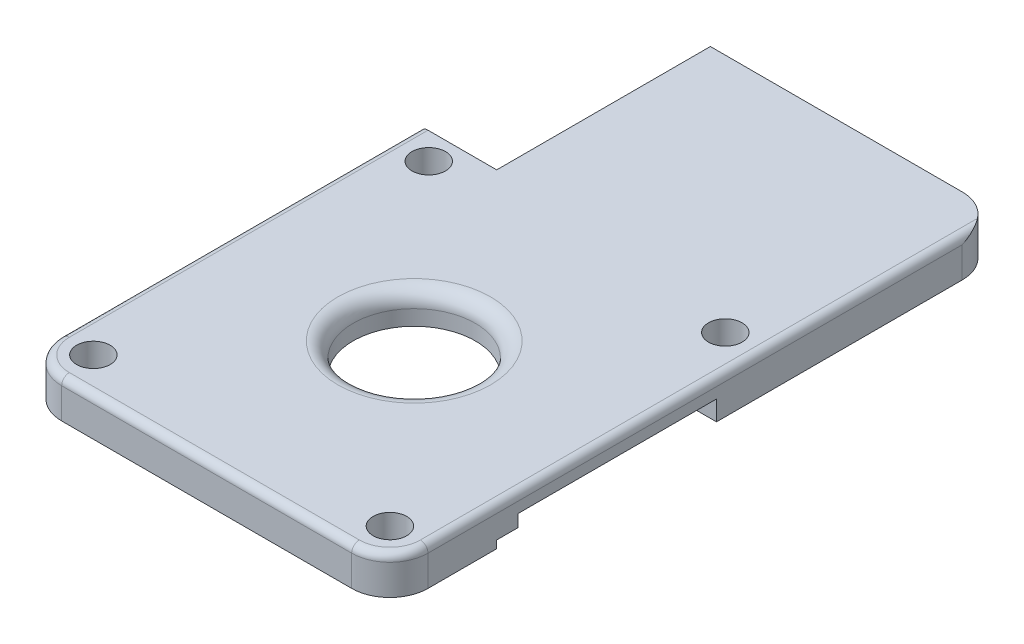
from build123d import *

# Parameters (mm, degrees)
SKETCH_1_R           = 1.1
SKETCH_1_R_2         = 4
EXTRUDE_1_DEPTH      = 2.5
SKETCH_2_W           = 14.4
SKETCH_2_H           = 0.5
CUT_EXTRUDE_1_DEPTH  = 37.005863078
SKETCH_3_W           = 13
SKETCH_3_H           = 1.3
CUT_EXTRUDE_2_DEPTH  = 4.5
SKETCH_4_W           = 13
SKETCH_4_H           = 1.3
CUT_EXTRUDE_3_DEPTH  = 4.5
SKETCH_5_W           = 11.5
SKETCH_5_H           = 17.3
CUT_EXTRUDE_11_DEPTH = 0.5
SKETCH_6_W           = 6
SKETCH_6_H           = 10
CUT_EXTRUDE_12_DEPTH = 0.5
FILLET_1_R           = 0.5
FILLET_2_R           = 1
SKETCH_7_W           = 4.3
SKETCH_7_H           = 13.3
CUT_EXTRUDE_13_DEPTH = 30.401057536
CHAMFER_1_SIZE       = 0.699461487
CHAMFER_1_SIZE_2     = 1.5


with BuildPart() as part:
    # 草图1 → 凸台-拉伸1 (new body)
    with BuildSketch(Plane(origin=(0, 0, 0), x_dir=(1, 0, 0), z_dir=(0, 1, 0))):
        with BuildLine():
            Line((-12, 24.224), (-12, -10.776))
            ThreePointArc((-12, -10.776), (-11.267766953, -12.543766953), (-9.5, -13.276))
            Line((-9.5, -13.276), (9.5, -13.276))
            ThreePointArc((9.5, -13.276), (11.267766953, -12.543766953), (12, -10.776))
            Line((12, -10.776), (12, 24.224))
            ThreePointArc((12, 24.224), (11.267766953, 25.991766953), (9.5, 26.724))
            Line((9.5, 26.724), (-9.5, 26.724))
            ThreePointArc((-9.5, 26.724), (-11.267766953, 25.991766953), (-12, 24.224))
        make_face()
        with Locations(Location((-9.714, -10.986, 0), (0, 0, 270))):
            Circle(SKETCH_1_R, mode=Mode.SUBTRACT)
        with Locations(Location((0, 0.32, 0), (0, 0, 270))):
            Circle(SKETCH_1_R_2, mode=Mode.SUBTRACT)
        with Locations(Location((9.714, -10.986, 0), (0, 0, 270))):
            Circle(SKETCH_1_R, mode=Mode.SUBTRACT)
        with Locations(Location((9.714, 10.986, 0), (0, 0, 270))):
            Circle(SKETCH_1_R, mode=Mode.SUBTRACT)
        with Locations(Location((-9.714, 10.986, 0), (0, 0, 270))):
            Circle(SKETCH_1_R, mode=Mode.SUBTRACT)
    extrude(amount=-EXTRUDE_1_DEPTH)

    # 草图2 → 切除-拉伸1 (cut, through all)
    with BuildSketch(Plane(origin=(12, 0, 0), x_dir=(0, 0, -1), z_dir=(1, 0, 0))):
        with Locations((0.924, -2.25)):
            Rectangle(SKETCH_2_W, SKETCH_2_H)
    extrude(amount=-CUT_EXTRUDE_1_DEPTH, mode=Mode.SUBTRACT)

    # 草图3 → 切除-拉伸2 (cut)
    with BuildSketch(Plane(origin=(12, 0, 0), x_dir=(0, 0, -1), z_dir=(1, 0, 0))):
        with Locations((1.624, -1.85)):
            Rectangle(SKETCH_3_W, SKETCH_3_H)
    extrude(amount=-CUT_EXTRUDE_2_DEPTH, mode=Mode.SUBTRACT)

    # 草图4 → 切除-拉伸3 (cut)
    with BuildSketch(Plane.ZY.offset(12)):
        with Locations((-1.624, -1.85)):
            Rectangle(SKETCH_4_W, SKETCH_4_H)
    extrude(amount=-CUT_EXTRUDE_3_DEPTH, mode=Mode.SUBTRACT)

    # 草图5 → 切除-拉伸11 (cut)
    with BuildSketch(Plane.XZ.offset(2.5)):
        with Locations((1.75, -16.774)):
            Rectangle(SKETCH_5_W, SKETCH_5_H)
    extrude(amount=-CUT_EXTRUDE_11_DEPTH, mode=Mode.SUBTRACT)

    # 草图6 → 切除-拉伸12 (cut)
    with BuildSketch(Plane.XZ.offset(2)):
        with Locations((-1, -13.124)):
            Rectangle(SKETCH_6_W, SKETCH_6_H)
    extrude(amount=-CUT_EXTRUDE_12_DEPTH, mode=Mode.SUBTRACT)

    # 圆角1
    # the kernel refuses this fillet: 0.5 mm, written as the material it takes off along each edge
    with BuildSketch(Plane(origin=(-9.5, 0, 13.276), x_dir=(0, 0, -1), z_dir=(1, 0, 0))) as fillet_1_piece_1:
        with BuildLine():
            CenterArc((FILLET_1_R, -FILLET_1_R), FILLET_1_R, 90, 90)
            Line((0, -FILLET_1_R), (-FILLET_1_R * 0.02, -FILLET_1_R))
            Line((-FILLET_1_R * 0.02, -FILLET_1_R), (-FILLET_1_R * 0.02, FILLET_1_R * 0.02))
            Line((-FILLET_1_R * 0.02, FILLET_1_R * 0.02), (FILLET_1_R, FILLET_1_R * 0.02))
            Line((FILLET_1_R, FILLET_1_R * 0.02), (FILLET_1_R, 0))
        make_face()
    extrude(amount=19, mode=Mode.SUBTRACT)
    with BuildSketch(Plane(origin=(-9.5, 0, 10.776), x_dir=(-1, 0, 0), z_dir=(0, 0, -1))) as fillet_1_piece_2:
        with BuildLine():
            CenterArc((2.5 - FILLET_1_R, -FILLET_1_R), FILLET_1_R, 0, 90)
            Line((2.5, -FILLET_1_R), (2.5 + FILLET_1_R * 0.02, -FILLET_1_R))
            Line((2.5 + FILLET_1_R * 0.02, -FILLET_1_R), (2.5 + FILLET_1_R * 0.02, FILLET_1_R * 0.02))
            Line((2.5 + FILLET_1_R * 0.02, FILLET_1_R * 0.02), (2.5 - FILLET_1_R, FILLET_1_R * 0.02))
            Line((2.5 - FILLET_1_R, FILLET_1_R * 0.02), (2.5 - FILLET_1_R, 0))
        make_face()
    revolve(axis=Axis((-9.5, 0, 10.776), (0, 1, 0)), revolution_arc=90, mode=Mode.SUBTRACT)
    with BuildSketch(Plane(origin=(-12, 0, -27.224), x_dir=(0, -1, 0), z_dir=(0, 0, 1))) as fillet_1_piece_3:
        with BuildLine():
            CenterArc((FILLET_1_R, FILLET_1_R), FILLET_1_R, 180, 90)
            Line((0, FILLET_1_R), (-FILLET_1_R * 0.02, FILLET_1_R))
            Line((-FILLET_1_R * 0.02, FILLET_1_R), (-FILLET_1_R * 0.02, -FILLET_1_R * 0.02))
            Line((-FILLET_1_R * 0.02, -FILLET_1_R * 0.02), (FILLET_1_R, -FILLET_1_R * 0.02))
            Line((FILLET_1_R, -FILLET_1_R * 0.02), (FILLET_1_R, 0))
        make_face()
    extrude(amount=38, mode=Mode.SUBTRACT)
    with BuildSketch(Plane(origin=(12, 0, 10.776), x_dir=(-1, 0, 0), z_dir=(0, 0, -1))) as fillet_1_piece_4:
        with BuildLine():
            CenterArc((FILLET_1_R, -FILLET_1_R), FILLET_1_R, 90, 90)
            Line((0, -FILLET_1_R), (-FILLET_1_R * 0.02, -FILLET_1_R))
            Line((-FILLET_1_R * 0.02, -FILLET_1_R), (-FILLET_1_R * 0.02, FILLET_1_R * 0.02))
            Line((-FILLET_1_R * 0.02, FILLET_1_R * 0.02), (FILLET_1_R, FILLET_1_R * 0.02))
            Line((FILLET_1_R, FILLET_1_R * 0.02), (FILLET_1_R, 0))
        make_face()
    extrude(amount=38, mode=Mode.SUBTRACT)
    with BuildSketch(Plane(origin=(9.5, 0, 10.776), x_dir=(0, 0, 1), z_dir=(-1, 0, 0))) as fillet_1_piece_5:
        with BuildLine():
            CenterArc((2.5 - FILLET_1_R, -FILLET_1_R), FILLET_1_R, 0, 90)
            Line((2.5, -FILLET_1_R), (2.5 + FILLET_1_R * 0.02, -FILLET_1_R))
            Line((2.5 + FILLET_1_R * 0.02, -FILLET_1_R), (2.5 + FILLET_1_R * 0.02, FILLET_1_R * 0.02))
            Line((2.5 + FILLET_1_R * 0.02, FILLET_1_R * 0.02), (2.5 - FILLET_1_R, FILLET_1_R * 0.02))
            Line((2.5 - FILLET_1_R, FILLET_1_R * 0.02), (2.5 - FILLET_1_R, 0))
        make_face()
    revolve(axis=Axis((9.5, 0, 10.776), (0, 1, 0)), revolution_arc=90, mode=Mode.SUBTRACT)

    # 圆角2
    fillet_2_edges = [part.edges().sort_by_distance(p)[0] for p in [
        (0, 0, -4.32),
    ]]
    fillet(fillet_2_edges, radius=FILLET_2_R)

    # 草图7 → 切除-拉伸13 (cut, through all)
    with BuildSketch(Plane(origin=(0, 0, 0), x_dir=(1, 0, 0), z_dir=(0, 1, 0))):
        with Locations((-9.85, 20.074)):
            Rectangle(SKETCH_7_W, SKETCH_7_H)
    extrude(amount=-CUT_EXTRUDE_13_DEPTH, mode=Mode.SUBTRACT)

    # 倒角1
    # the kernel refuses this chamfer: 1.5, 0.699461487 mm, written as the material it takes off along each edge
    with BuildSketch(Plane(origin=(-7.7, 0, -13.424), x_dir=(0, 0.07481330637059964, 0.9971975577536774), z_dir=(-1, 0, 0))) as chamfer_1_piece_1:
        Polygon((CHAMFER_1_SIZE * 0.997197558085, -CHAMFER_1_SIZE * 0.0748133063955), (-CHAMFER_1_SIZE_2 * 0.0748133063706, -CHAMFER_1_SIZE_2 * 0.997197557754), (0, 0), align=None)
    extrude(amount=7.686463207, mode=Mode.SUBTRACT)
    with BuildSketch(Plane(origin=(-7.7, 0, -30.610463207), x_dir=(0.9971975577536775, 0.07481330637059957, 0), z_dir=(0, 0, 1))) as chamfer_1_piece_2:
        Polygon((CHAMFER_1_SIZE * 0.997197558085, -CHAMFER_1_SIZE * 0.0748133063955), (-CHAMFER_1_SIZE_2 * 0.0748133063706, -CHAMFER_1_SIZE_2 * 0.997197557754), (0, 0), align=None)
    extrude(amount=17.186463207, mode=Mode.SUBTRACT)
    with BuildSketch(Plane(origin=(-3.813536793, 0, -13.424), x_dir=(0, 0.07481330637059964, 0.9971975577536774), z_dir=(-1, 0, 0))) as chamfer_1_piece_3a_section:
        Polygon((CHAMFER_1_SIZE * 0.997197558085, -CHAMFER_1_SIZE * 0.0748133063955), (-CHAMFER_1_SIZE_2 * 0.0748133063706, -CHAMFER_1_SIZE_2 * 0.997197557754), (0, 0), align=None)
    chamfer_1_piece_3a = extrude(amount=11.572926414, mode=Mode.PRIVATE)
    chamfer_1_piece_3a = split(chamfer_1_piece_3a, bisect_by=Plane(origin=(-7.7, -0.507353362, -13.203429624), z_dir=(1, 0, 0)), keep=Keep.TOP, mode=Mode.PRIVATE)
    with BuildSketch(Plane(origin=(-7.7, 0, -30.610463207), x_dir=(0.9971975577536775, 0.07481330637059957, 0), z_dir=(0, 0, 1))) as chamfer_1_piece_3b_section:
        Polygon((CHAMFER_1_SIZE * 0.997197558085, -CHAMFER_1_SIZE * 0.0748133063955), (-CHAMFER_1_SIZE_2 * 0.0748133063706, -CHAMFER_1_SIZE_2 * 0.997197557754), (0, 0), align=None)
    chamfer_1_piece_3b = extrude(amount=21.072926414, mode=Mode.PRIVATE)
    chamfer_1_piece_3b = split(chamfer_1_piece_3b, bisect_by=Plane(origin=(-7.479429624, -0.507353362, -13.424), z_dir=(0, 0, 1)), keep=Keep.TOP, mode=Mode.PRIVATE)
    chamfer_1_piece_3 = chamfer_1_piece_3a & chamfer_1_piece_3b
    add(chamfer_1_piece_3, mode=Mode.SUBTRACT)


solid = part.part
